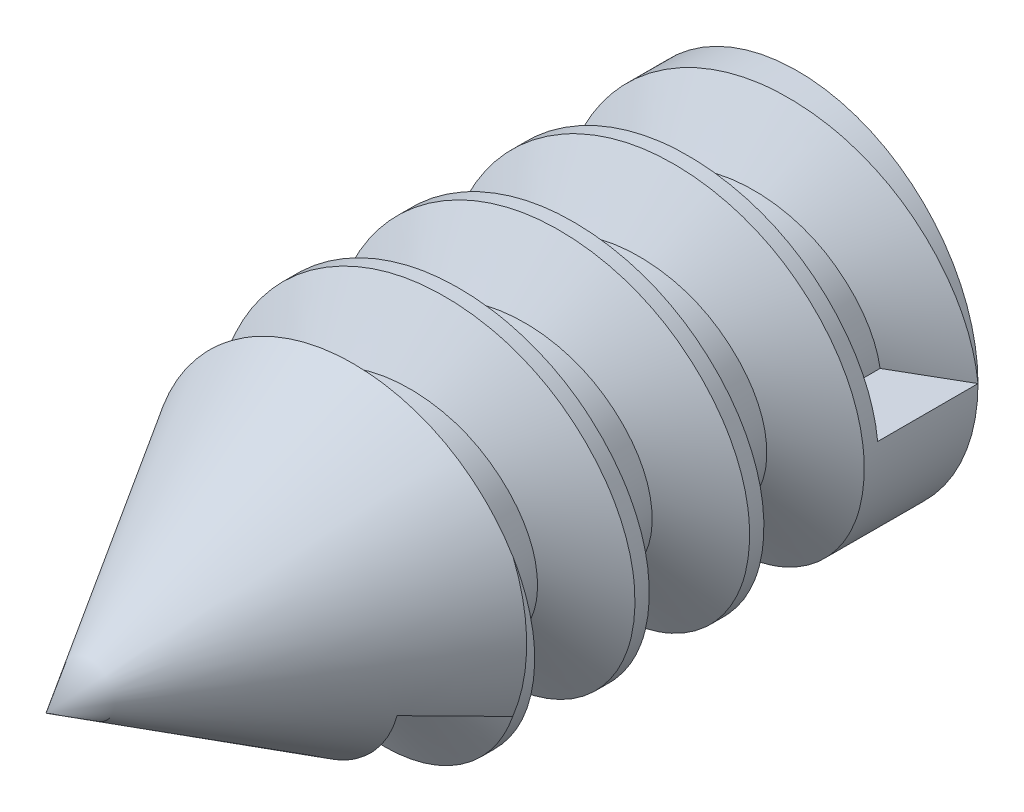
from build123d import *

# Parameters (mm, degrees)
SKETCH_1_R      = 2
EXTRUDE_1_DEPTH = 5
THREAD_1_PITCH  = 1.27


with BuildPart() as part:
    # Sketch 1 → 凸台-拉伸1 (new body)
    with BuildSketch(Plane.XY):
        Circle(SKETCH_1_R)
    extrude(amount=EXTRUDE_1_DEPTH)

    # 草图2 → 旋转1 (revolve)
    with BuildSketch(Plane(origin=(0, 0, 0), x_dir=(0, 0, -1), z_dir=(1, 0, 0)), mode=Mode.PRIVATE) as revolve_1_sk:
        Polygon((-5, 0), (-8.325258403, 0), (-5, 2), align=None)
    revolve(revolve_1_sk.sketch.rotate(Axis((0, 0, 5), (0, 0, 1)), 90), axis=Axis((0, 0, 5), (0, 0, 1)))

    # 螺纹线1: the profile of Sketch 1 2 profile screwed along a right-hand helix of 3.937008 turns, 8 arcs to a turn; built about Z, then put on its axis
    thread_1_z = Axis((0, 0, 0), (0, 0, 1))
    thread_1_corners = [(2.0003, 0, -0.000173205), (2.0003, 0, 1.111423202), (1.312592339, 0, 0.714374998), (1.312592339, 0, 0.396874998)]
    with BuildLine(mode=Mode.PRIVATE) as thread_1_profile:
        Line(thread_1_corners[0], thread_1_corners[1])
        Line(thread_1_corners[1], thread_1_corners[2])
        Line(thread_1_corners[2], thread_1_corners[3])
        Line(thread_1_corners[3], thread_1_corners[0])
    thread_1_cap = Face(thread_1_profile.wire())
    thread_1_turn_angles = [0, 22.5, 45, 67.5, 90, 112.5, 135, 157.5, 180, 202.5, 225, 247.5, 270, 292.5, 315, 337.5, 360]
    thread_1_turn_weights = [1, 0.9238795325112867, 1, 0.9238795325112867, 1, 0.9238795325112867, 1, 0.9238795325112867, 1, 0.9238795325112867, 1, 0.9238795325112867, 1, 0.9238795325112867, 1, 0.9238795325112867, 1]
    thread_1_turn_rails = [Edge.make_bspline([Vector(p[0], p[1], 0).rotate(thread_1_z, thread_1_turn_angles[k]) / thread_1_turn_weights[k] + Vector(0, 0, p[2] + THREAD_1_PITCH * thread_1_turn_angles[k] / 360) for k in range(17)], [0, 0, 0, 1, 1, 2, 2, 3, 3, 4, 4, 5, 5, 6, 6, 7, 7, 8, 8, 8], 2, thread_1_turn_weights) for p in thread_1_corners]
    thread_1_turn_sides = [Face.make_surface_from_curves(thread_1_turn_rails[p[0]], thread_1_turn_rails[p[1]]) for p in [(0, 1), (1, 2), (2, 3), (3, 0)]]
    thread_1_last_angles = [1080, 1102.5, 1125, 1147.5, 1170, 1192.5, 1215, 1237.5, 1260, 1282.5, 1305, 1327.5, 1350, 1372.5, 1395, 1406.161417323, 1417.322834646]
    thread_1_last_weights = [1, 0.9238795325112867, 1, 0.9238795325112867, 1, 0.9238795325112867, 1, 0.9238795325112867, 1, 0.9238795325112867, 1, 0.9238795325112867, 1, 0.9238795325112867, 1, 0.9810857293196427, 1]
    thread_1_last_rails = [Edge.make_bspline([Vector(p[0], p[1], 0).rotate(thread_1_z, thread_1_last_angles[k]) / thread_1_last_weights[k] + Vector(0, 0, p[2] + THREAD_1_PITCH * thread_1_last_angles[k] / 360) for k in range(17)], [0, 0, 0, 1, 1, 2, 2, 3, 3, 4, 4, 5, 5, 6, 6, 7, 7, 8, 8, 8], 2, thread_1_last_weights) for p in thread_1_corners]
    thread_1_last_sides = [Face.make_surface_from_curves(thread_1_last_rails[p[0]], thread_1_last_rails[p[1]]) for p in [(0, 1), (1, 2), (2, 3), (3, 0)]]
    thread_1 = Plane(origin=(0, 0, 0), x_dir=(1, 0, 0), z_dir=(0, 0, 1)) * Solid(Shell([*[p.moved(Location((0, 0, THREAD_1_PITCH * i))) for i in range(3) for p in thread_1_turn_sides], *thread_1_last_sides, thread_1_cap, thread_1_cap.rotate(thread_1_z, 1417.322834646).moved(Location((0, 0, THREAD_1_PITCH * 1417.322834646 / 360)))]))
    add(thread_1, mode=Mode.SUBTRACT)


solid = part.part
